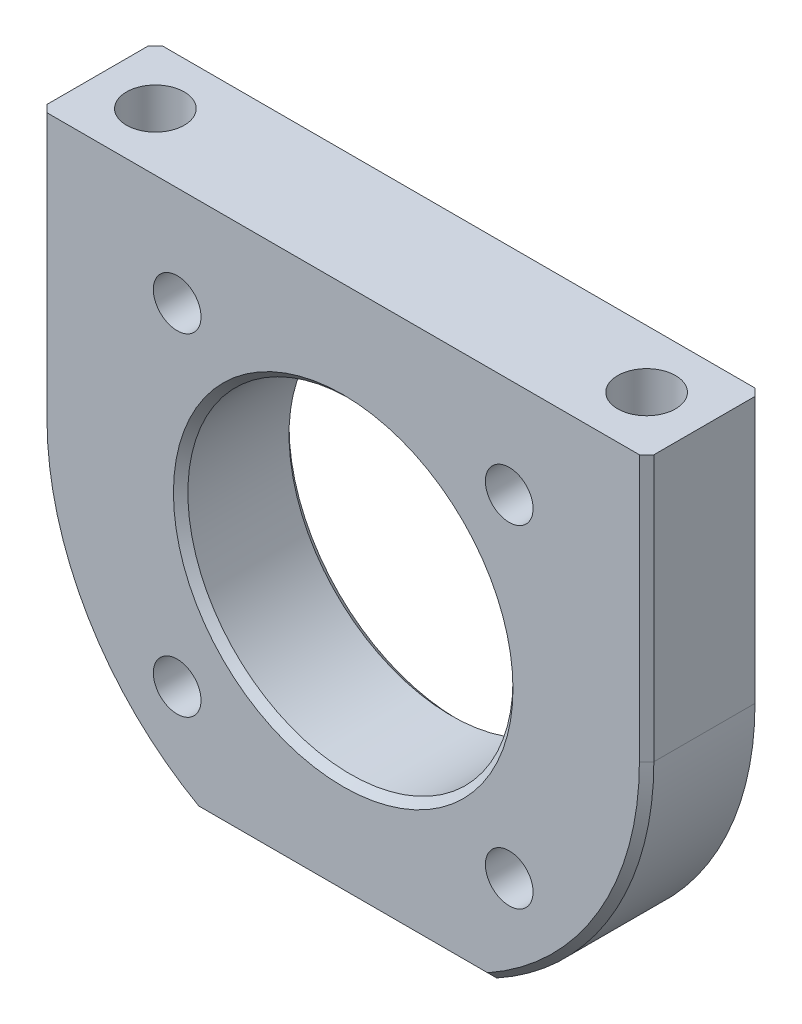
from build123d import *

# Parameters (mm, degrees)
BOSS_EXTRUDE1_DEPTH       = 4
SKETCH2_R                 = 11.25
CUT_EXTRUDE1_DEPTH        = 30.044104393
M4X0_7_TAPPED_HOLE3_D     = 3.3
M4X0_7_TAPPED_HOLE1_D     = 3.3
M4X0_7_TAPPED_HOLE1_DEPTH = 8
M4X0_7_TAPPED_HOLE1_TIP   = 0.991420021
SKETCH6_R                 = 2
CUT_EXTRUDE3_DEPTH        = 8
CHAMFER1_SIZE             = 0.5


with BuildPart() as part:
    # Sketch1 → Boss-Extrude1 (new, symmetric)
    with BuildSketch(Plane.XY):
        with BuildLine():
            Line((21, 0), (21, 18.4))
            Line((21, 18.4), (-21, 18.4))
            Line((-21, 18.4), (-21, 0))
            ThreePointArc((-21, 0), (-18.076871405, -10.687690125), (-10.121264743, -18.4))
            Line((-10.121264743, -18.4), (10.121264743, -18.4))
            ThreePointArc((10.121264743, -18.4), (18.076871405, -10.687690125), (21, 0))
        make_face()
    extrude(amount=BOSS_EXTRUDE1_DEPTH, both=True)

    # Sketch2 → Cut-Extrude1 (cut, through all)
    with BuildSketch(Plane.XY.offset(4)):
        Circle(SKETCH2_R)
    extrude(amount=-CUT_EXTRUDE1_DEPTH, mode=Mode.SUBTRACT)

    # M4x0.7 Tapped Hole3 (through all)
    with Locations(Plane.XY.offset(4)):
        with Locations((-11.490485194, 11.490485194), (11.490485194, 11.490485194), (11.490485194, -11.490485194), (-11.490485194, -11.490485194)):
            Hole(M4X0_7_TAPPED_HOLE3_D / 2)

    # M4x0.7 Tapped Hole1
    with Locations(Plane(origin=(0, 18.4, 0), x_dir=(1, 0, 0), z_dir=(0, 1, 0))):
        with Locations((-17, 0), (17, 0)):
            Hole(M4X0_7_TAPPED_HOLE1_D / 2, depth=M4X0_7_TAPPED_HOLE1_DEPTH)
            with Locations((0, 0, -(M4X0_7_TAPPED_HOLE1_DEPTH + M4X0_7_TAPPED_HOLE1_TIP / 2))):  # 118° drill point
                Cone(0, M4X0_7_TAPPED_HOLE1_D / 2, M4X0_7_TAPPED_HOLE1_TIP, mode=Mode.SUBTRACT)

    # Sketch6 → Cut-Extrude3 (cut)
    with BuildSketch(Plane(origin=(-3.375, 18.4, 0), x_dir=(0, 0, -1), z_dir=(0, -1, 0))):
        with Locations((0, -13.625)):
            Circle(SKETCH6_R)
        with Locations((0, 20.375)):
            Circle(SKETCH6_R)
    extrude(amount=CUT_EXTRUDE3_DEPTH, mode=Mode.SUBTRACT)

    # Chamfer1
    chamfer1_edges = [part.edges().sort_by_distance(p)[0] for p in [
        (-11.25, 0, -4),
        (-21, 9.2, 4),
        (-18.076871405, -10.687690125, 4),
        (0, -18.4, 4),
        (18.076871405, -10.687690125, 4),
        (21, 9.2, 4),
        (-21, 9.2, -4),
        (-18.076871405, -10.687690125, -4),
        (0, -18.4, -4),
        (18.076871405, -10.687690125, -4),
        (21, 9.2, -4),
        (-11.25, 0, 4),
    ]]
    chamfer(chamfer1_edges, length=CHAMFER1_SIZE)


solid = part.part
